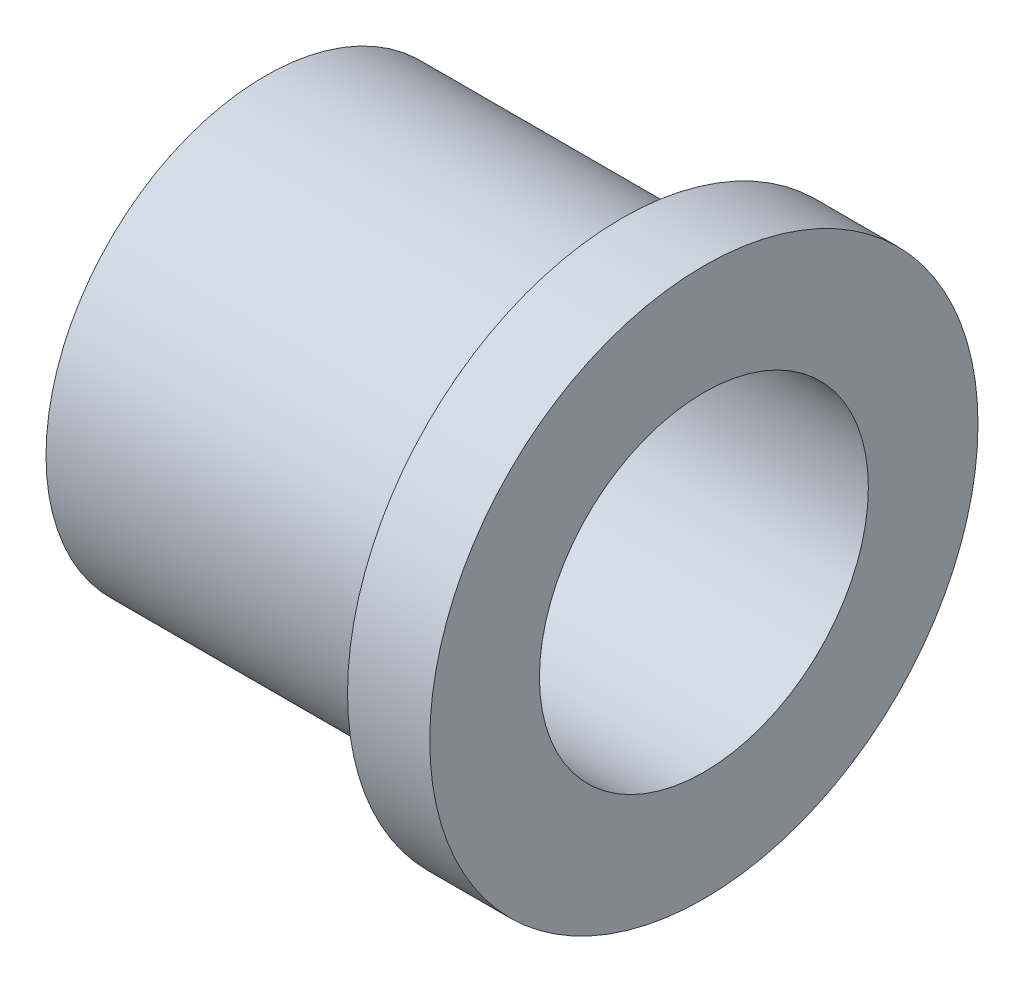
from build123d import *


with BuildPart() as part:
    # Sketch1 → Revolve1 (revolve)
    with BuildSketch(Plane.XY):
        Polygon((-25.4, 12.7), (-4.7625, 12.7), (-4.7625, 15.875), (0, 15.875), (0, 9.525), (-25.4, 9.525), align=None)
    revolve(axis=Axis((0, 0, 0), (1, 0, 0)))


solid = part.part
